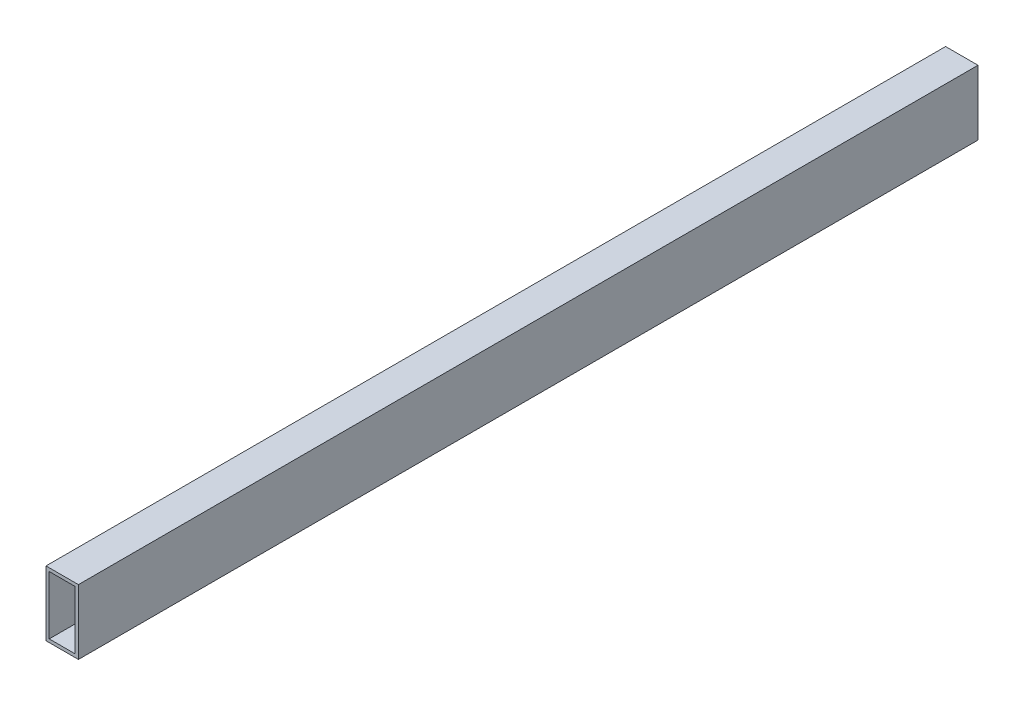
from build123d import *

# Parameters (mm, degrees)
SKETCH1_W           = 25.4
SKETCH1_H           = 50.8
SKETCH1_W_2         = 20.32
SKETCH1_H_2         = 45.72
EXTRUDE_THIN1_DEPTH = 704.85


with BuildPart() as part:
    # Sketch1 → Extrude-Thin1 (new body)
    with BuildSketch(Plane.XY):
        Rectangle(SKETCH1_W, SKETCH1_H)
        Rectangle(SKETCH1_W_2, SKETCH1_H_2, mode=Mode.SUBTRACT)
    extrude(amount=EXTRUDE_THIN1_DEPTH)


solid = part.part
